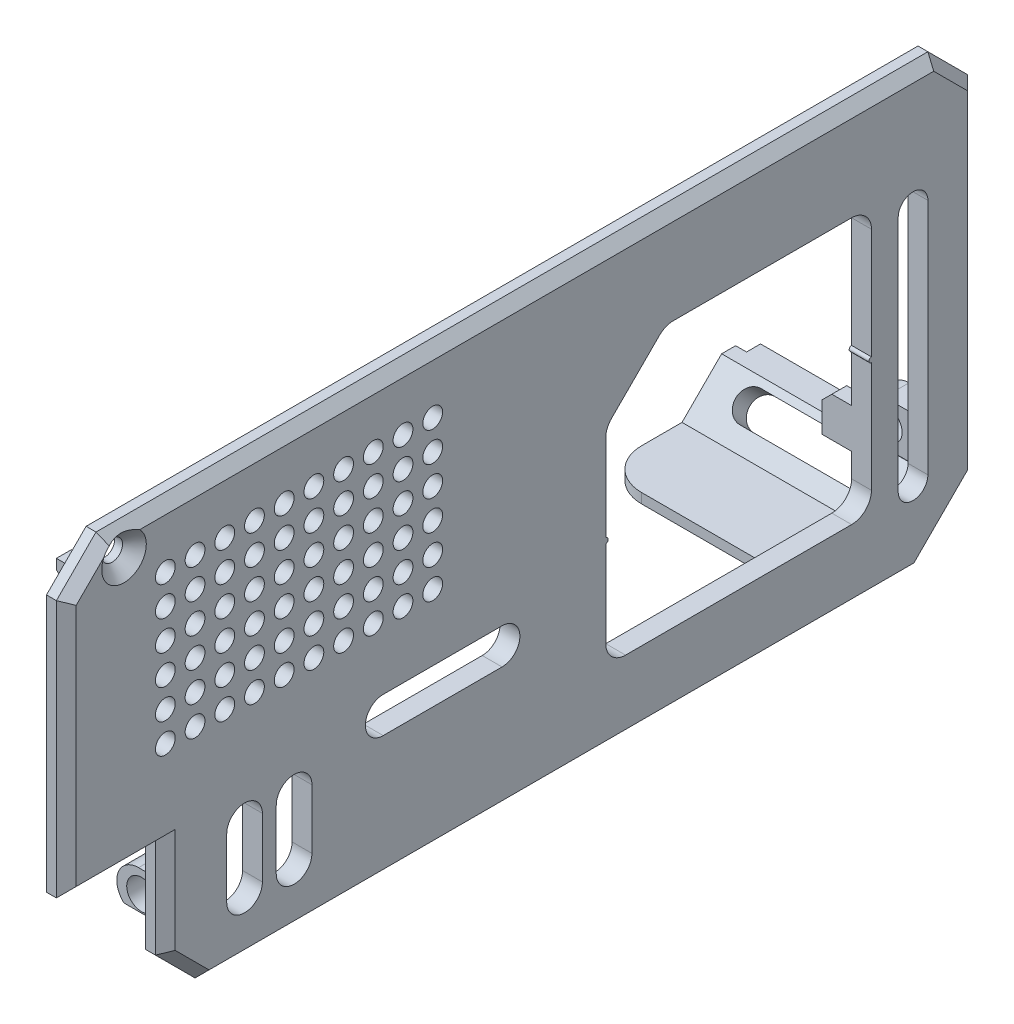
from build123d import *

# Parameters (mm, degrees)
EXTRUDE_1_DEPTH      = 2
CHAMFER_1_SIZE       = 1
EXTRUDE_2_DEPTH      = 1
SKETCH_3_W           = 1.5
SKETCH_3_H           = 4
EXTRUDE_3_DEPTH      = 3
CHAMFER_2_SIZE       = 1
CUT_EXTRUDE_START    = -62
SKETCH_4_R           = 1
CUT_EXTRUDE_1_DEPTH  = 2
CUT_EXTRUDE_2_REACH  = 72.412
CUT_EXTRUDE_3_REACH  = 72.412
SKETCH_7_W           = 1.5
SKETCH_7_H           = 2
EXTRUDE_4_DEPTH      = 5
CHAMFER_3_SIZE       = 1
CUT_EXTRUDE_6_REACH  = 72.526
SKETCH_8_W           = 2
SKETCH_8_H           = 5
EXTRUDE_5_DEPTH      = 1
SKETCH_12_W          = 2.5
SKETCH_12_H          = 4.4
EXTRUDE_6_DEPTH      = 5
CUT_EXTRUDE_7_REACH  = 98.064
SKETCH_14_R          = 1.5
EXTRUDE_7_DEPTH      = 5
CUT_EXTRUDE_8_REACH  = 88.777
SKETCH_17_R          = 1.5
FILLET_1_R           = 2.2
SKETCH_18_W          = 5.1
SKETCH_18_H          = 3.7
CUT_EXTRUDE_9_DEPTH  = 1
CUT_EXTRUDE_10_REACH = 72.696
SKETCH_19_R          = 1.05
CHAMFER_4_SIZE       = 1.2
EXTRUDE_8_DEPTH      = 21
CUT_EXTRUDE_13_DEPTH = 1.1
SKETCH_23_W          = 19.9
SKETCH_23_H          = 1
CUT_EXTRUDE_14_DEPTH = 1.1
FILLET_2_R           = 3.1
FILLET_3_R           = 4.1
CUT_EXTRUDE_15_DEPTH = 95.321898501
SKETCH_28_W          = 6
SKETCH_28_H          = 2.701102253
CUT_EXTRUDE_17_DEPTH = 1
CUT_EXTRUDE_18_REACH = 76.013
SKETCH_30_R          = 0.25
EXTRUDE_9_DEPTH      = 2


# Some blends are built 0.0001 mm under size
with BuildPart() as part:
    # 草图1 → 凸台-拉伸1 (new body)
    with BuildSketch(Plane(origin=(0, 0, 0), x_dir=(0, 0, -1), z_dir=(1, 0, 0))):
        Polygon((61.867818396, 29.484952634), (57.867818396, 33.484952634), (-26.132181604, 33.484952634), (-30.132181604, 29.484952634), (-30.132181604, 3.484952634), (-20.132181604, 3.484952634), (-20.132181604, -6.515047366), (-16.132181604, -10.515047366), (55.867818396, -10.515047366), (61.867818396, -4.515047366), align=None)
    extrude(amount=EXTRUDE_1_DEPTH)

    # 倒角1
    chamfer_1_edges = [part.edges().sort_by_distance(p)[0] for p in [
        (2, 33.484952634, -15.867818396),
        (2, 31.484952634, 28.132181604),
        (2, 16.484952634, 30.132181604),
        (2, 3.484952634, 25.132181604),
        (2, -1.515047366, 20.132181604),
        (2, -8.515047366, 18.132181604),
        (2, -10.515047366, -19.867818396),
        (2, -7.515047366, -58.867818396),
        (2, 12.484952634, -61.867818396),
        (2, 31.484952634, -59.867818396),
    ]]
    chamfer(chamfer_1_edges, length=CHAMFER_1_SIZE)

    # 草图2 → 凸台-拉伸2 (add)
    with BuildSketch(Plane.ZY):
        Polygon((-59.767818396, 28.615104153), (-59.767818396, -3.645198886), (-54.997969915, -8.415047366), (15.262333123, -8.415047366), (18.032181604, -5.645198886), (18.032181604, 5.584952634), (28.032181604, 5.584952634), (28.032181604, 28.615104153), (25.262333123, 31.384952634), (-56.997969915, 31.384952634), align=None)
        Polygon((-58.767818396, 28.20089059), (-58.767818396, -3.230985323), (-54.583756353, -7.415047366), (14.84811956, -7.415047366), (17.032181604, -5.230985323), (17.032181604, 6.584952634), (27.032181604, 6.584952634), (27.032181604, 28.20089059), (24.84811956, 30.384952634), (-56.583756353, 30.384952634), align=None, mode=Mode.SUBTRACT)
    extrude(amount=EXTRUDE_2_DEPTH)

    # 草图3 → 凸台-拉伸3 (add)
    with BuildSketch(Plane.ZY):
        with Locations((-51.917818396, 3.384952634)):
            Rectangle(SKETCH_3_W, SKETCH_3_H)
        with Locations((0.882181604, 3.384952634)):
            Rectangle(SKETCH_3_W, SKETCH_3_H)
    extrude(amount=EXTRUDE_3_DEPTH)

    # 倒角2
    chamfer_2_edges = [part.edges().sort_by_distance(p)[0] for p in [
        (-3, 5.384952634, -51.917818396),
        (-3, 5.384952634, 0.882181604),
    ]]
    chamfer(chamfer_2_edges, length=CHAMFER_2_SIZE)

    # 草图4 → 切除-拉伸1 (cut)
    with BuildSketch(Plane.ZY.offset(60).offset(CUT_EXTRUDE_START)):
        with Locations(Location((20.132181604, 27.484952634, 0), (0, 0, 180))):
            Circle(SKETCH_4_R)
        with Locations(Location((17.132181604, 27.484952634, 0), (0, 0, 180))):
            Circle(SKETCH_4_R)
        with Locations(Location((14.132181604, 27.484952634, 0), (0, 0, 180))):
            Circle(SKETCH_4_R)
        with Locations(Location((11.132181604, 27.484952634, 0), (0, 0, 180))):
            Circle(SKETCH_4_R)
        with Locations(Location((8.132181604, 27.484952634, 0), (0, 0, 180))):
            Circle(SKETCH_4_R)
        with Locations(Location((5.132181604, 27.484952634, 0), (0, 0, 180))):
            Circle(SKETCH_4_R)
        with Locations(Location((17.132181604, 24.484952634, 0), (0, 0, 180))):
            Circle(SKETCH_4_R)
        with Locations(Location((14.132181604, 24.484952634, 0), (0, 0, 180))):
            Circle(SKETCH_4_R)
        with Locations(Location((11.132181604, 24.484952634, 0), (0, 0, 180))):
            Circle(SKETCH_4_R)
        with Locations(Location((8.132181604, 24.484952634, 0), (0, 0, 180))):
            Circle(SKETCH_4_R)
        with Locations(Location((5.132181604, 24.484952634, 0), (0, 0, 180))):
            Circle(SKETCH_4_R)
        with Locations(Location((17.132181604, 21.484952634, 0), (0, 0, 180))):
            Circle(SKETCH_4_R)
        with Locations(Location((14.132181604, 21.484952634, 0), (0, 0, 180))):
            Circle(SKETCH_4_R)
        with Locations(Location((11.132181604, 21.484952634, 0), (0, 0, 180))):
            Circle(SKETCH_4_R)
        with Locations(Location((8.132181604, 21.484952634, 0), (0, 0, 180))):
            Circle(SKETCH_4_R)
        with Locations(Location((5.132181604, 21.484952634, 0), (0, 0, 180))):
            Circle(SKETCH_4_R)
        with Locations(Location((17.132181604, 18.484952634, 0), (0, 0, 180))):
            Circle(SKETCH_4_R)
        with Locations(Location((14.132181604, 18.484952634, 0), (0, 0, 180))):
            Circle(SKETCH_4_R)
        with Locations(Location((11.132181604, 18.484952634, 0), (0, 0, 180))):
            Circle(SKETCH_4_R)
        with Locations(Location((8.132181604, 18.484952634, 0), (0, 0, 180))):
            Circle(SKETCH_4_R)
        with Locations(Location((5.132181604, 18.484952634, 0), (0, 0, 180))):
            Circle(SKETCH_4_R)
        with Locations(Location((17.132181604, 15.484952634, 0), (0, 0, 180))):
            Circle(SKETCH_4_R)
        with Locations(Location((14.132181604, 15.484952634, 0), (0, 0, 180))):
            Circle(SKETCH_4_R)
        with Locations(Location((11.132181604, 15.484952634, 0), (0, 0, 180))):
            Circle(SKETCH_4_R)
        with Locations(Location((8.132181604, 15.484952634, 0), (0, 0, 180))):
            Circle(SKETCH_4_R)
        with Locations(Location((5.132181604, 15.484952634, 0), (0, 0, 180))):
            Circle(SKETCH_4_R)
        with Locations(Location((17.132181604, 12.484952634, 0), (0, 0, 180))):
            Circle(SKETCH_4_R)
        with Locations(Location((14.132181604, 12.484952634, 0), (0, 0, 180))):
            Circle(SKETCH_4_R)
        with Locations(Location((11.132181604, 12.484952634, 0), (0, 0, 180))):
            Circle(SKETCH_4_R)
        with Locations(Location((8.132181604, 12.484952634, 0), (0, 0, 180))):
            Circle(SKETCH_4_R)
        with Locations(Location((5.132181604, 12.484952634, 0), (0, 0, 180))):
            Circle(SKETCH_4_R)
        with Locations(Location((20.132181604, 24.484952634, 0), (0, 0, 180))):
            Circle(SKETCH_4_R)
        with Locations(Location((20.132181604, 21.484952634, 0), (0, 0, 180))):
            Circle(SKETCH_4_R)
        with Locations(Location((20.132181604, 18.484952634, 0), (0, 0, 180))):
            Circle(SKETCH_4_R)
        with Locations(Location((20.132181604, 15.484952634, 0), (0, 0, 180))):
            Circle(SKETCH_4_R)
        with Locations(Location((20.132181604, 12.484952634, 0), (0, 0, 180))):
            Circle(SKETCH_4_R)
        with Locations(Location((2.132181604, 27.484952634, 0), (0, 0, 180))):
            Circle(SKETCH_4_R)
        with Locations(Location((-0.867818396, 27.484952634, 0), (0, 0, 180))):
            Circle(SKETCH_4_R)
        with Locations(Location((-3.867818396, 27.484952634, 0), (0, 0, 180))):
            Circle(SKETCH_4_R)
        with Locations(Location((-6.867818396, 27.484952634, 0), (0, 0, 180))):
            Circle(SKETCH_4_R)
        with Locations(Location((2.132181604, 24.484952634, 0), (0, 0, 180))):
            Circle(SKETCH_4_R)
        with Locations(Location((-0.867818396, 24.484952634, 0), (0, 0, 180))):
            Circle(SKETCH_4_R)
        with Locations(Location((-3.867818396, 24.484952634, 0), (0, 0, 180))):
            Circle(SKETCH_4_R)
        with Locations(Location((-6.867818396, 24.484952634, 0), (0, 0, 180))):
            Circle(SKETCH_4_R)
        with Locations(Location((2.132181604, 21.484952634, 0), (0, 0, 180))):
            Circle(SKETCH_4_R)
        with Locations(Location((-0.867818396, 21.484952634, 0), (0, 0, 180))):
            Circle(SKETCH_4_R)
        with Locations(Location((-3.867818396, 21.484952634, 0), (0, 0, 180))):
            Circle(SKETCH_4_R)
        with Locations(Location((-6.867818396, 21.484952634, 0), (0, 0, 180))):
            Circle(SKETCH_4_R)
        with Locations(Location((2.132181604, 18.484952634, 0), (0, 0, 180))):
            Circle(SKETCH_4_R)
        with Locations(Location((-0.867818396, 18.484952634, 0), (0, 0, 180))):
            Circle(SKETCH_4_R)
        with Locations(Location((-3.867818396, 18.484952634, 0), (0, 0, 180))):
            Circle(SKETCH_4_R)
        with Locations(Location((-6.867818396, 18.484952634, 0), (0, 0, 180))):
            Circle(SKETCH_4_R)
        with Locations(Location((2.132181604, 15.484952634, 0), (0, 0, 180))):
            Circle(SKETCH_4_R)
        with Locations(Location((-0.867818396, 15.484952634, 0), (0, 0, 180))):
            Circle(SKETCH_4_R)
        with Locations(Location((-3.867818396, 15.484952634, 0), (0, 0, 180))):
            Circle(SKETCH_4_R)
        with Locations(Location((-6.867818396, 15.484952634, 0), (0, 0, 180))):
            Circle(SKETCH_4_R)
        with Locations(Location((2.132181604, 12.484952634, 0), (0, 0, 180))):
            Circle(SKETCH_4_R)
        with Locations(Location((-0.867818396, 12.484952634, 0), (0, 0, 180))):
            Circle(SKETCH_4_R)
        with Locations(Location((-3.867818396, 12.484952634, 0), (0, 0, 180))):
            Circle(SKETCH_4_R)
        with Locations(Location((-6.867818396, 12.484952634, 0), (0, 0, 180))):
            Circle(SKETCH_4_R)
    extrude(amount=CUT_EXTRUDE_1_DEPTH, mode=Mode.SUBTRACT)

    # 草图5 → 切除-拉伸2 (cut, up to next)
    with BuildSketch(Plane.ZY, mode=Mode.PRIVATE) as cut_extrude_2_sk1:
        with BuildLine():
            Line((13.932181604, -4.515047366), (13.932181604, 1.484952634))
            ThreePointArc((13.932181604, 1.484952634), (12.132181604, 3.284952634), (10.332181604, 1.484952634))
            Line((10.332181604, 1.484952634), (10.332181604, -4.515047366))
            ThreePointArc((10.332181604, -4.515047366), (12.132181604, -6.315047366), (13.932181604, -4.515047366))
        make_face()
    cut_extrude_2_tool1 = extrude(cut_extrude_2_sk1.sketch, amount=-CUT_EXTRUDE_2_REACH, mode=Mode.PRIVATE) & part.part
    # 草图5 → 切除-拉伸2 (cut, up to next)
    with BuildSketch(Plane.ZY, mode=Mode.PRIVATE) as cut_extrude_2_sk2:
        with BuildLine():
            Line((5.332181604, 1.484952634), (5.332181604, -4.515047366))
            ThreePointArc((5.332181604, -4.515047366), (7.132181604, -6.315047366), (8.932181604, -4.515047366))
            Line((8.932181604, -4.515047366), (8.932181604, 1.484952634))
            ThreePointArc((8.932181604, 1.484952634), (7.132181604, 3.284952634), (5.332181604, 1.484952634))
        make_face()
    cut_extrude_2_tool2 = extrude(cut_extrude_2_sk2.sketch, amount=-CUT_EXTRUDE_2_REACH, mode=Mode.PRIVATE) & part.part
    add(cut_extrude_2_tool1.solids().sort_by_distance((0, -1.515047, 12.132182))[0], mode=Mode.SUBTRACT)
    add(cut_extrude_2_tool2.solids().sort_by_distance((0, -1.515047, 7.132182))[0], mode=Mode.SUBTRACT)

    # 草图6 → 切除-拉伸3 (cut, up to next)
    with BuildSketch(Plane.ZY, mode=Mode.PRIVATE) as cut_extrude_3_sk1:
        with BuildLine():
            Line((-53.867818396, 21.484952634), (-53.867818396, -2.515047366))
            ThreePointArc((-53.867818396, -2.515047366), (-55.367818396, -4.015047366), (-56.867818396, -2.515047366))
            Line((-56.867818396, -2.515047366), (-56.867818396, 21.484952634))
            ThreePointArc((-56.867818396, 21.484952634), (-55.367818396, 22.984952634), (-53.867818396, 21.484952634))
        make_face()
    cut_extrude_3_tool1 = extrude(cut_extrude_3_sk1.sketch, amount=-CUT_EXTRUDE_3_REACH, mode=Mode.PRIVATE) & part.part
    add(cut_extrude_3_tool1.solids().sort_by_distance((0, 9.484953, -55.367818))[0], mode=Mode.SUBTRACT)

    # 草图7 → 凸台-拉伸4 (add)
    with BuildSketch(Plane.ZY):
        with Locations((23.382181604, 26.184952634)):
            Rectangle(SKETCH_7_W, SKETCH_7_H)
    extrude(amount=EXTRUDE_4_DEPTH)

    # 倒角3
    chamfer_3_edges = [part.edges().sort_by_distance(p)[0] for p in [
        (-5, 25.184952634, 23.382181604),
    ]]
    chamfer(chamfer_3_edges, length=CHAMFER_3_SIZE)

    # 草图9 → 切除-拉伸6 (cut, up to next)
    with BuildSketch(Plane.ZY, mode=Mode.PRIVATE) as cut_extrude_6_sk1:
        with BuildLine():
            Line((-51.167818396, 21.813379758), (-51.167818396, -1.015047366))
            ThreePointArc((-51.167818396, -1.015047366), (-50.582031959, -2.429260929), (-49.167818396, -3.015047366))
            Line((-49.167818396, -3.015047366), (-26.339391272, -3.015047366))
            ThreePointArc((-26.339391272, -3.015047366), (-24.925177709, -2.429260929), (-24.339391272, -1.015047366))
            Line((-24.339391272, -1.015047366), (-24.339391272, 16.984952634))
            ThreePointArc((-24.339391272, 16.984952634), (-24.491632207, 17.750319498), (-24.925177709, 18.399166196))
            Line((-24.925177709, 18.399166196), (-29.753604834, 23.227593321))
            ThreePointArc((-29.753604834, 23.227593321), (-30.402451532, 23.661138823), (-31.167818396, 23.813379758))
            Line((-31.167818396, 23.813379758), (-49.167818396, 23.813379758))
            ThreePointArc((-49.167818396, 23.813379758), (-50.582031959, 23.227593321), (-51.167818396, 21.813379758))
        make_face()
    cut_extrude_6_tool1 = extrude(cut_extrude_6_sk1.sketch, amount=-CUT_EXTRUDE_6_REACH, mode=Mode.PRIVATE) & part.part
    add(cut_extrude_6_tool1.solids().sort_by_distance((0, 10.118626, -38.034145))[0], mode=Mode.SUBTRACT)

    # 草图8 → 凸台-拉伸5 (add)
    with BuildSketch(Plane.ZY):
        with Locations((2.132181604, 8.184952634)):
            Rectangle(SKETCH_8_W, SKETCH_8_H)
    extrude(amount=EXTRUDE_5_DEPTH)

    # 草图12 → 凸台-拉伸6 (add)
    with BuildSketch(Plane.ZY):
        with Locations((-58.517818396, 24.284952634)):
            Rectangle(SKETCH_12_W, SKETCH_12_H)
        with Locations((-58.517818396, -0.515047366)):
            Rectangle(SKETCH_12_W, SKETCH_12_H)
    extrude(amount=EXTRUDE_6_DEPTH)

    # 草图14 → 切除-拉伸7 (cut, up to next)
    with BuildSketch(Plane(origin=(0, 0, -59.767818396), x_dir=(-1, 0, 0), z_dir=(0, 0, -1)), mode=Mode.PRIVATE) as cut_extrude_7_sk1:
        with Locations((2.5, 24.284952634)):
            Circle(SKETCH_14_R)
    cut_extrude_7_tool1 = extrude(cut_extrude_7_sk1.sketch, amount=-CUT_EXTRUDE_7_REACH, mode=Mode.PRIVATE) & part.part
    # 草图14 → 切除-拉伸7 (cut, up to next)
    with BuildSketch(Plane(origin=(0, 0, -59.767818396), x_dir=(-1, 0, 0), z_dir=(0, 0, -1)), mode=Mode.PRIVATE) as cut_extrude_7_sk2:
        with Locations((2.5, -0.515047366)):
            Circle(SKETCH_14_R)
    cut_extrude_7_tool2 = extrude(cut_extrude_7_sk2.sketch, amount=-CUT_EXTRUDE_7_REACH, mode=Mode.PRIVATE) & part.part
    add(cut_extrude_7_tool1.solids().sort_by_distance((-2.5, 24.284953, -59.767818))[0], mode=Mode.SUBTRACT)
    add(cut_extrude_7_tool2.solids().sort_by_distance((-2.5, -0.515047, -59.767818))[0], mode=Mode.SUBTRACT)

    # 草图16 → 凸台-拉伸7 (add)
    with BuildSketch(Plane.ZY):
        Polygon((15.532181604, -6.215047366), (17.462333123, -6.215047366), (18.032181604, -5.645198886), (18.032181604, -1.815047366), (15.532181604, -1.815047366), align=None)
    extrude(amount=EXTRUDE_7_DEPTH)

    # 草图17 → 切除-拉伸8 (cut, up to next)
    with BuildSketch(Plane.XY.offset(18.032181604), mode=Mode.PRIVATE) as cut_extrude_8_sk1:
        with Locations((-2.5, -4.015047366)):
            Circle(SKETCH_17_R)
    cut_extrude_8_tool1 = extrude(cut_extrude_8_sk1.sketch, amount=-CUT_EXTRUDE_8_REACH, mode=Mode.PRIVATE) & part.part
    add(cut_extrude_8_tool1.solids().sort_by_distance((-2.5, -4.015047, 18.032182))[0], mode=Mode.SUBTRACT)

    # 圆角1
    fillet_1_edges = [part.edges().sort_by_distance(p)[0] for p in [
        (-5, 22.084952634, -58.517818396),
        (-5, 26.484952634, -58.517818396),
        (-5, 1.684952634, -58.517818396),
        (-5, -2.715047366, -58.517818396),
        (-5, -6.215047366, 16.497257363),
        (-5, -1.815047366, 16.782181604),
    ]]
    fillet(fillet_1_edges, radius=FILLET_1_R - 0.0001)  # a hair under: the kernel refuses the full size

    # 草图18 → 切除-拉伸9 (cut)
    with BuildSketch(Plane.ZY.offset(1)):
        with Locations((26.582181604, 30.634952634)):
            Rectangle(SKETCH_18_W, SKETCH_18_H)
    extrude(amount=-CUT_EXTRUDE_9_DEPTH, mode=Mode.SUBTRACT)

    # 草图19 → 切除-拉伸10 (cut, up to next)
    with BuildSketch(Plane(origin=(2, 0, 0), x_dir=(0, 0, -1), z_dir=(1, 0, 0)), mode=Mode.PRIVATE) as cut_extrude_10_sk1:
        with Locations((-24.303754479, 30.884952634)):
            Circle(SKETCH_19_R)
    cut_extrude_10_tool1 = extrude(cut_extrude_10_sk1.sketch, amount=-CUT_EXTRUDE_10_REACH, mode=Mode.PRIVATE) & part.part
    add(cut_extrude_10_tool1.solids().sort_by_distance((2, 30.884953, 24.303754))[0], mode=Mode.SUBTRACT)

    # 倒角4
    # the kernel refuses this chamfer: 1.2 mm, written as the material it takes off along each edge
    with BuildSketch(Plane(origin=(2, 30.884952634, 24.303754479), x_dir=(0, 0, -1), z_dir=(0, -1, 0))) as chamfer_4_piece_1:
        Polygon((1.05, -CHAMFER_4_SIZE), (1.05 + CHAMFER_4_SIZE, 0), (1.05, 0), align=None)
    revolve(axis=Axis((2, 30.884952634, 24.303754479), (1, 0, 0)), mode=Mode.SUBTRACT)

    # 草图20 → 凸台-拉伸8 (add)
    with BuildSketch(Plane.ZY):
        Polygon((-61.867818396, -4.515047366), (-55.867818396, -10.515047366), (-46.867818396, -10.515047366), (-46.867818396, -8.515047366), (-55.039391272, -8.515047366), (-59.039391272, -4.515047366), align=None)
    extrude(amount=EXTRUDE_8_DEPTH)

    # 草图21 → 切除-拉伸13 (cut)
    with BuildSketch(Plane.ZY.offset(21)):
        Polygon((-55.453604834, -9.515047366), (-46.867818396, -9.515047366), (-46.867818396, -10.515047366), (-55.867818396, -10.515047366), (-61.867818396, -4.515047366), (-60.453604834, -4.515047366), align=None)
    extrude(amount=-CUT_EXTRUDE_13_DEPTH, mode=Mode.SUBTRACT)

    # 草图23 → 切除-拉伸14 (cut)
    with BuildSketch(Plane.XY.offset(-46.867818396)):
        with Locations((-9.95, -10.015047366)):
            Rectangle(SKETCH_23_W, SKETCH_23_H)
    extrude(amount=-CUT_EXTRUDE_14_DEPTH, mode=Mode.SUBTRACT)

    # 圆角2
    fillet_2_edges = [part.edges().sort_by_distance(p)[0] for p in [
        (-19.9, -10.015047366, -47.967818396),
    ]]
    fillet(fillet_2_edges, radius=FILLET_2_R)

    # 圆角3
    fillet_3_edges = [part.edges().sort_by_distance(p)[0] for p in [
        (-21, -9.015047366, -46.867818396),
    ]]
    fillet(fillet_3_edges, radius=FILLET_3_R)

    # 草图24 → 切除-拉伸15 (cut, through all)
    with BuildSketch(Plane(origin=(0, -33.191432881, -33.191432881), x_dir=(1, 0, 0), z_dir=(0, -0.7071067811865486, -0.7071067811865465))):
        with BuildLine():
            Line((-4.5, -37.811892628), (-16.5, -37.811892628))
            ThreePointArc((-16.5, -37.811892628), (-18, -36.311892628), (-16.5, -34.811892628))
            Line((-16.5, -34.811892628), (-4.5, -34.811892628))
            ThreePointArc((-4.5, -34.811892628), (-3, -36.311892628), (-4.5, -37.811892628))
        make_face()
    extrude(amount=-CUT_EXTRUDE_15_DEPTH, mode=Mode.SUBTRACT)

    # 草图28 → 切除-拉伸17 (cut)
    with BuildSketch(Plane.ZY.offset(1)):
        with Locations((25.05556741, 30.134401508)):
            Rectangle(SKETCH_28_W, SKETCH_28_H)
    extrude(amount=-CUT_EXTRUDE_17_DEPTH, mode=Mode.SUBTRACT)

    # 草图29 → 切除-拉伸18 (cut, up to next)
    with BuildSketch(Plane(origin=(2, 0, 0), x_dir=(0, 0, -1), z_dir=(1, 0, 0)), mode=Mode.PRIVATE) as cut_extrude_18_sk1:
        with BuildLine():
            Line((13.867818396, 2.184952634), (1.867818396, 2.184952634))
            ThreePointArc((1.867818396, 2.184952634), (0.067818396, 3.984952634), (1.867818396, 5.784952634))
            Line((1.867818396, 5.784952634), (13.867818396, 5.784952634))
            ThreePointArc((13.867818396, 5.784952634), (15.667818396, 3.984952634), (13.867818396, 2.184952634))
        make_face()
    cut_extrude_18_tool1 = extrude(cut_extrude_18_sk1.sketch, amount=-CUT_EXTRUDE_18_REACH, mode=Mode.PRIVATE) & part.part
    add(cut_extrude_18_tool1.solids().sort_by_distance((2, 3.984953, -7.867818))[0], mode=Mode.SUBTRACT)

    # 草图30 → 凸台-拉伸9 (add)
    with BuildSketch(Plane(origin=(2, 0, 0), x_dir=(0, 0, -1), z_dir=(1, 0, 0))):
        with Locations((24.339391272, 7.984952634)):
            Circle(SKETCH_30_R)
        with Locations((51.167818396, 10.399166196)):
            Circle(SKETCH_30_R)
    extrude(amount=-EXTRUDE_9_DEPTH)


solid = part.part
